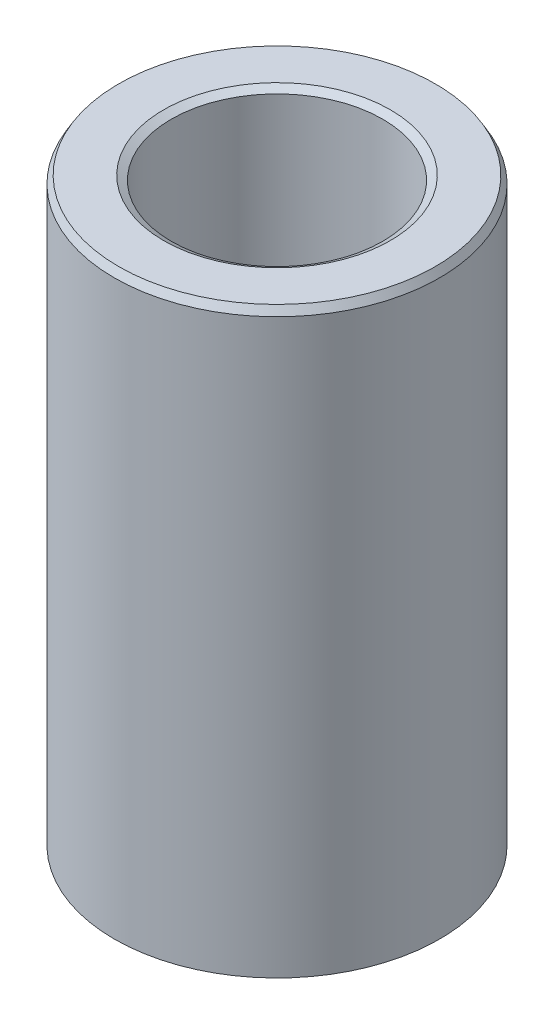
from build123d import *
from OCP.BRepFilletAPI import BRepFilletAPI_MakeChamfer

# Parameters (mm, degrees)
SKETCH1_R           = 50
BOSS_EXTRUDE1_DEPTH = 179.683679777
SKETCH2_R           = 32.513352137
CUT_EXTRUDE1_DEPTH  = 194.096413167
CHAMFER1_SIZE       = 2.328996125
CHAMFER1_SIZE2      = 1.34464654


with BuildPart() as part:
    # Sketch1 → Boss-Extrude1 (new body)
    with BuildSketch(Plane(origin=(0, 0, 0), x_dir=(1, 0, 0), z_dir=(0, 1, 0))):
        Circle(SKETCH1_R)
    extrude(amount=BOSS_EXTRUDE1_DEPTH)

    # Sketch2 → Cut-Extrude1 (cut, through all)
    with BuildSketch(Plane(origin=(0, 0, 0), x_dir=(1, 0, 0), z_dir=(0, 1, 0))):
        Circle(SKETCH2_R)
    extrude(amount=CUT_EXTRUDE1_DEPTH, mode=Mode.SUBTRACT)

    # Chamfer1: one chamfer whose edges measure the first distance from different faces: ONE call of the kernel's chamfer builder (chamfer() names one face for all edges)
    chamfer1_edges_1 = [part.edges().sort_by_distance(p)[0] for p in [
        (-32.513352137, 179.683679777, 0),
    ]]
    chamfer1_side_1 = [part.faces().sort_by_distance(p)[0] for p in [
        (-48.585786438, 179.683679777, 0),
    ]]
    chamfer1_edges_2 = [part.edges().sort_by_distance(p)[0] for p in [
        (-32.513352137, 0, 0),
    ]]
    chamfer1_side_2 = [part.faces().sort_by_distance(p)[0] for p in [
        (-32.513352137, 89.841839888, 0),
    ]]
    chamfer1_edges_3 = [part.edges().sort_by_distance(p)[0] for p in [
        (-50, 0, 0),
    ]]
    chamfer1_side_3 = [part.faces().sort_by_distance(p)[0] for p in [
        (-48.585786438, 0, 0),
    ]]
    chamfer1_edges_4 = [part.edges().sort_by_distance(p)[0] for p in [
        (-50, 179.683679777, 0),
    ]]
    chamfer1_side_4 = [part.faces().sort_by_distance(p)[0] for p in [
        (-50, 89.841839888, 0),
    ]]
    chamfer1 = BRepFilletAPI_MakeChamfer(part.part.solid().wrapped)
    for e in chamfer1_edges_1:
        chamfer1.Add(CHAMFER1_SIZE, CHAMFER1_SIZE2, e.wrapped, chamfer1_side_1[0].wrapped)  # the first distance lies on this face
    for e in chamfer1_edges_2:
        chamfer1.Add(CHAMFER1_SIZE, CHAMFER1_SIZE2, e.wrapped, chamfer1_side_2[0].wrapped)  # the first distance lies on this face
    for e in chamfer1_edges_3:
        chamfer1.Add(CHAMFER1_SIZE, CHAMFER1_SIZE2, e.wrapped, chamfer1_side_3[0].wrapped)  # the first distance lies on this face
    for e in chamfer1_edges_4:
        chamfer1.Add(CHAMFER1_SIZE, CHAMFER1_SIZE2, e.wrapped, chamfer1_side_4[0].wrapped)  # the first distance lies on this face
    add(Compound.cast(chamfer1.Shape()), mode=Mode.REPLACE)


solid = part.part
